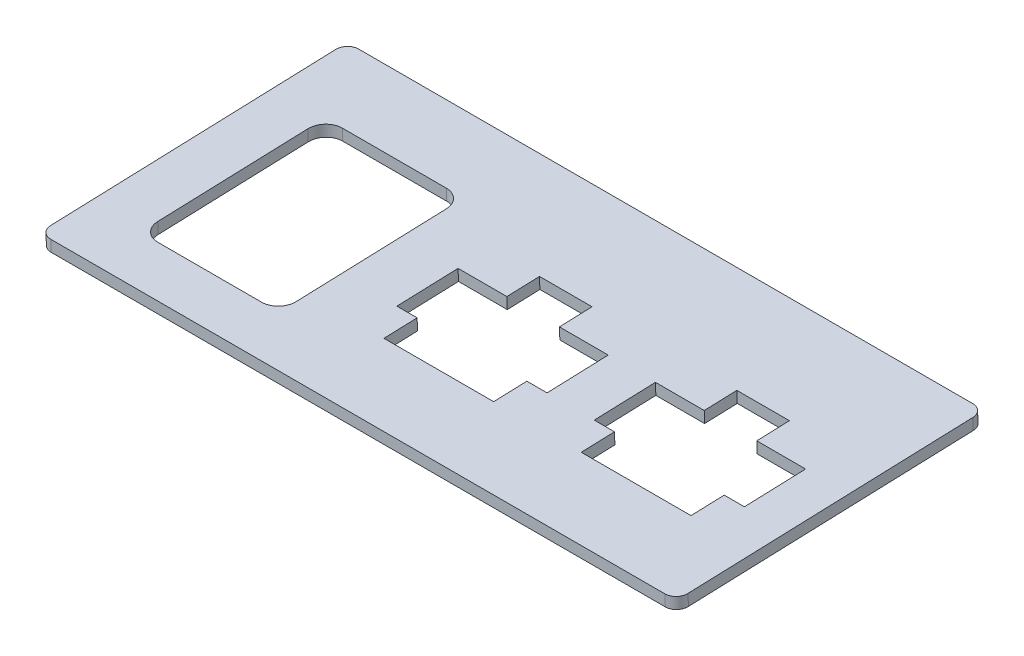
from build123d import *

# Parameters (mm, degrees)
SKETCH1_W           = 110.35
SKETCH1_H           = 53.351168776
BOSS_EXTRUDE1_DEPTH = 2
CUT_EXTRUDE1_REACH  = 75.895
FILLET1_R           = 2


with BuildPart() as part:
    # Sketch1 → Boss-Extrude1 (new body)
    with BuildSketch(Plane(origin=(0, -69.240689652, -2.417938163), x_dir=(1, 0, 0), z_dir=(0, 0.9993908270190958, 0.03489949670250105))):
        with Locations((0, 22.368687598)):
            Rectangle(SKETCH1_W, SKETCH1_H)
    extrude(amount=BOSS_EXTRUDE1_DEPTH)

    # Sketch2 → Cut-Extrude1 (cut, up to next)
    with BuildSketch(Plane(origin=(0, -69.240689652, -2.417938163), x_dir=(1, 0, 0), z_dir=(0, -0.9993908270190958, -0.03489949670250106)), mode=Mode.PRIVATE) as cut_extrude1_sk1:
        Polygon((-4.05, -25.568778974), (-4.05, -31.218778974), (5.05, -31.218778974), (5.05, -25.568778974), (13.5, -25.568778974), (13.5, -14.968778974), (10, -14.968778974), (10, -9.218778974), (-9, -9.218778974), (-9, -14.968778974), (-12.5, -14.968778974), (-12.5, -25.568778974), align=None)
    cut_extrude1_tool1 = extrude(cut_extrude1_sk1.sketch, amount=-CUT_EXTRUDE1_REACH, mode=Mode.PRIVATE) & part.part
    # Sketch2 → Cut-Extrude1 (cut, up to next)
    with BuildSketch(Plane(origin=(0, -69.240689652, -2.417938163), x_dir=(1, 0, 0), z_dir=(0, -0.9993908270190958, -0.03489949670250106)), mode=Mode.PRIVATE) as cut_extrude1_sk2:
        with BuildLine():
            Line((-43.175, -4.218778974), (-25.175, -4.218778974))
            ThreePointArc((-25.175, -4.218778974), (-23.053679656, -5.09745863), (-22.175, -7.218778974))
            Line((-22.175, -7.218778974), (-22.175, -33.218778974))
            ThreePointArc((-22.175, -33.218778974), (-23.053679656, -35.340099317), (-25.175, -36.218778974))
            Line((-25.175, -36.218778974), (-43.175, -36.218778974))
            ThreePointArc((-43.175, -36.218778974), (-45.296320344, -35.340099317), (-46.175, -33.218778974))
            Line((-46.175, -33.218778974), (-46.175, -7.218778974))
            ThreePointArc((-46.175, -7.218778974), (-45.296320344, -5.09745863), (-43.175, -4.218778974))
        make_face()
    cut_extrude1_tool2 = extrude(cut_extrude1_sk2.sketch, amount=-CUT_EXTRUDE1_REACH, mode=Mode.PRIVATE) & part.part
    # Sketch2 → Cut-Extrude1 (cut, up to next)
    with BuildSketch(Plane(origin=(0, -69.240689652, -2.417938163), x_dir=(1, 0, 0), z_dir=(0, -0.9993908270190958, -0.03489949670250106)), mode=Mode.PRIVATE) as cut_extrude1_sk3:
        Polygon((30.125, -25.568778974), (21.675, -25.568778974), (21.675, -14.968778974), (25.175, -14.968778974), (25.175, -9.218778974), (44.175, -9.218778974), (44.175, -14.968778974), (47.675, -14.968778974), (47.675, -25.568778974), (39.225, -25.568778974), (39.225, -31.218778974), (30.125, -31.218778974), align=None)
    cut_extrude1_tool3 = extrude(cut_extrude1_sk3.sketch, amount=-CUT_EXTRUDE1_REACH, mode=Mode.PRIVATE) & part.part
    add(cut_extrude1_tool1.solids().sort_by_distance((0.5, -68.571347, -21.585394))[0], mode=Mode.SUBTRACT)
    add(cut_extrude1_tool2.solids().sort_by_distance((-34.175, -68.535064, -22.6244))[0], mode=Mode.SUBTRACT)
    add(cut_extrude1_tool3.solids().sort_by_distance((34.675, -68.571347, -21.585394))[0], mode=Mode.SUBTRACT)

    # Fillet1
    fillet1_edges = [part.edges().sort_by_distance(p)[0] for p in [
        (-55.175, -68.391607355, 1.921234479),
        (55.175, -68.391607355, 1.921234479),
        (55.175, -66.529678416, -51.397434207),
        (-55.175, -66.529678416, -51.397434207),
    ]]
    fillet(fillet1_edges, radius=FILLET1_R)


solid = part.part
